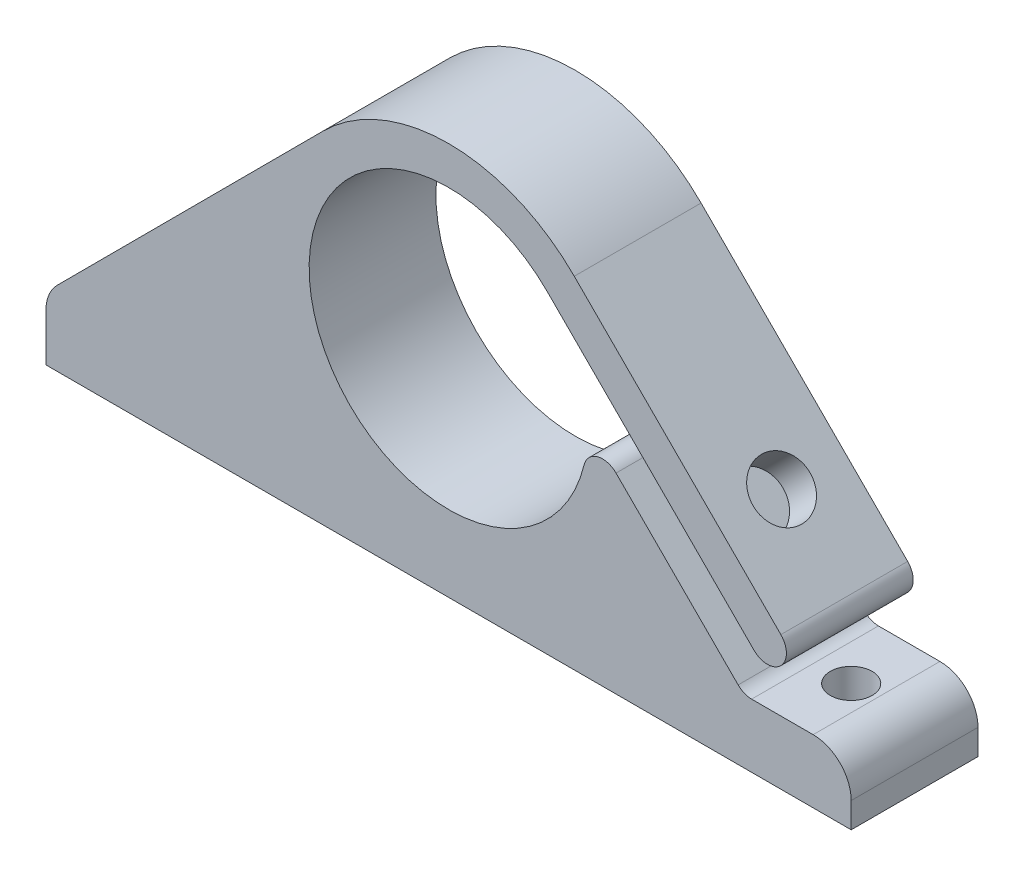
from build123d import *

# Parameters (mm, degrees)
SKETCH_1_R            = 11
EXTRUDE_1_DEPTH       = 10
CUT_EXTRUDE_1_DEPTH   = 38.37729926
FILLET_1_R            = 1.5
M4X0_71_D             = 3.3
M4X0_71_DEPTH         = 5
M4X0_71_TIP           = 0.991420021
HOLE_WIZARD_M41_D     = 4.5
HOLE_WIZARD_M41_DEPTH = 3
M4X0_72_D             = 3.3
M4X0_72_DEPTH         = 10
M4X0_72_TIP           = 0.991420021
FILLET_2_R            = 3


with BuildPart() as part:
    # Эскиз1 → Бобышка-Вытянуть1 (new body)
    with BuildSketch(Plane.XY):
        with BuildLine():
            Line((-31.75, -12), (-9.910576673, 9.888400781))
            ThreePointArc((-9.910576673, 9.888400781), (0, 14), (9.910576673, 9.888400781))
            Line((9.910576673, 9.888400781), (31.75, -12))
            Line((31.75, -12), (31.75, -17))
            Line((31.75, -17), (-31.75, -17))
            Line((-31.75, -17), (-31.75, -12))
        make_face()
        Circle(SKETCH_1_R, mode=Mode.SUBTRACT)
    extrude(amount=EXTRUDE_1_DEPTH)

    # Эскиз2 → Вырез-Вытянуть1 (cut, through all)
    with BuildSketch(Plane.XY.offset(10)):
        Polygon((7.786881672, 7.769457757), (24.518816114, -9), (31.75, -9), (31.75, -12), (23.274206636, -12), (10.995743008, 0.305999515), align=None)
    extrude(amount=-CUT_EXTRUDE_1_DEPTH, mode=Mode.SUBTRACT)

    # Скругление1
    fillet_1_edges = [part.edges().sort_by_distance(p)[0] for p in [
        (23.274206636, -12, 5),
        (24.518816114, -9, 5),
        (28.756712796, -9, 5),
        (10.995743008, 0.305999515, 5),
    ]]
    fillet(fillet_1_edges, radius=FILLET_1_R - 0.0001)  # a hair under: the kernel refuses the full size

    # Отверстие обработанное метчиком M4x0.71
    with Locations(Plane(origin=(0, -17, 0), x_dir=(-1, 0, 0), z_dir=(0, -1, 0))):
        with Locations((26.75, -5), (-26.75, -5)):
            Hole(M4X0_71_D / 2, depth=M4X0_71_DEPTH)
            with Locations((0, 0, -(M4X0_71_DEPTH + M4X0_71_TIP / 2))):  # 118° drill point
                Cone(0, M4X0_71_D / 2, M4X0_71_TIP, mode=Mode.SUBTRACT)

    # Отверстие с зазором M41
    with Locations(Plane(origin=(9.910576673, 9.888400781, 0), x_dir=(0, 0, -1), z_dir=(0.7078983337955254, 0.7063143415006656, 0))):
        with Locations((-5, -16.066771723)):
            Hole(HOLE_WIZARD_M41_D / 2, depth=HOLE_WIZARD_M41_DEPTH)

    # Отверстие обработанное метчиком M4x0.72
    with Locations(Plane(origin=(5.66318667, 5.650514732, 0), x_dir=(0, 0, -1), z_dir=(0.7078983337955258, 0.7063143415006653, 0))):
        with Locations((-5, -16.066771723)):
            Hole(M4X0_72_D / 2, depth=M4X0_72_DEPTH)
            with Locations((0, 0, -(M4X0_72_DEPTH + M4X0_72_TIP / 2))):  # 118° drill point
                Cone(0, M4X0_72_D / 2, M4X0_72_TIP, mode=Mode.SUBTRACT)

    # Скругление2
    fillet_2_edges = [part.edges().sort_by_distance(p)[0] for p in [
        (-31.75, -12, 5),
        (31.75, -12, 5),
    ]]
    fillet(fillet_2_edges, radius=FILLET_2_R)


solid = part.part
